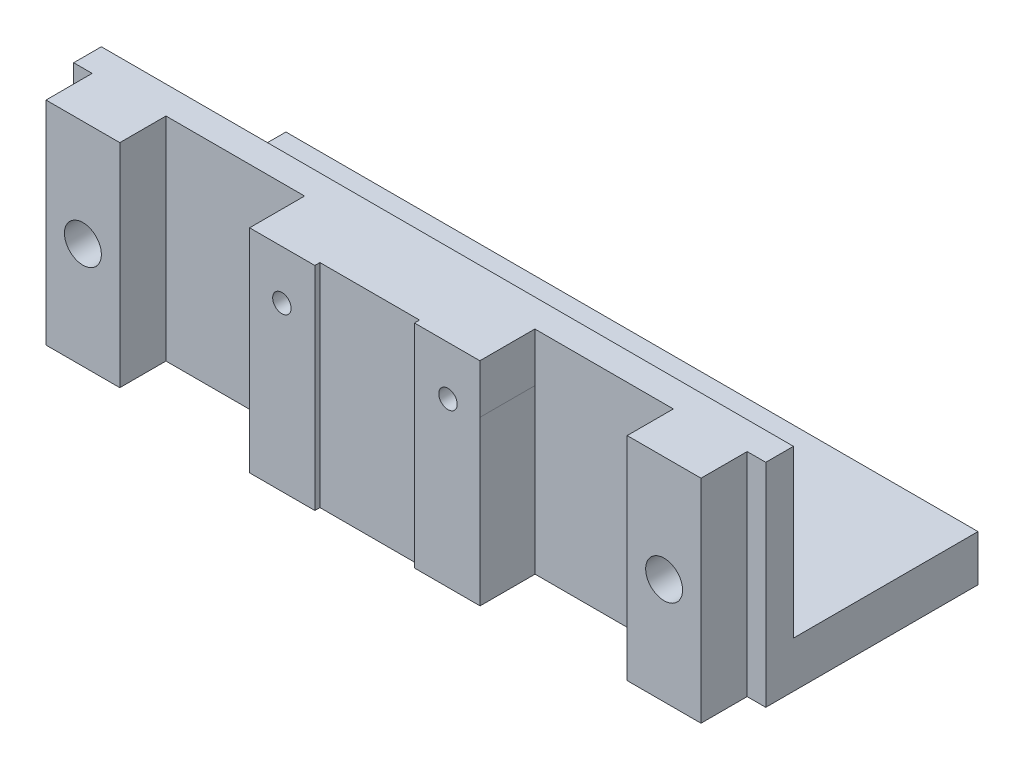
from build123d import *

# Parameters (mm, degrees)
SKETCH1_W            = 50
SKETCH1_H            = 23
BOSS_EXTRUDE12_DEPTH = 3
SKETCH17_W           = 50
SKETCH17_H           = 3
BOSS_EXTRUDE13_DEPTH = 20
BOSS_EXTRUDE15_DEPTH = 25
SKETCH19_R           = 3
CUT_EXTRUDE1_DEPTH   = 10
BOSS_EXTRUDE17_DEPTH = 5.96
CUT_EXTRUDE2_DEPTH   = 58.739515066
SKETCH23_R           = 1
CUT_EXTRUDE3_DEPTH   = 63.190687406
SKETCH24_W           = 8
SKETCH24_H           = 23
BOSS_EXTRUDE20_DEPTH = 5
BOSS_EXTRUDE22_START = 3
SKETCH20_R           = 4
SKETCH20_R_2         = 3
BOSS_EXTRUDE22_DEPTH = 3
SKETCH25_R           = 2
CUT_EXTRUDE4_DEPTH   = 62.749493925
SKETCH26_W           = 75
SKETCH26_H           = 20
BOSS_EXTRUDE23_DEPTH = 2
SKETCH27_R           = 3
CUT_EXTRUDE5_DEPTH   = 57.611408744


with BuildPart() as part:
    # Sketch1 → Boss-Extrude12 (new body)
    with BuildSketch(Plane(origin=(0, 0, 0), x_dir=(1, 0, 0), z_dir=(0, 1, 0))):
        Rectangle(SKETCH1_W, SKETCH1_H)
    extrude(amount=BOSS_EXTRUDE12_DEPTH)

    # Sketch17 → Boss-Extrude13 (add)
    with BuildSketch(Plane(origin=(0, 3, 0), x_dir=(1, 0, 0), z_dir=(0, 1, 0))):
        with Locations((0, -10)):
            Rectangle(SKETCH17_W, SKETCH17_H)
    extrude(amount=BOSS_EXTRUDE13_DEPTH)

    # Sketch18 → Boss-Extrude15 (add)
    with BuildSketch(Plane(origin=(25, 0, 0), x_dir=(0, 0, -1), z_dir=(1, 0, 0))):
        Polygon((-11.5, 23), (-8.5, 23), (-8.5, 3), (11.5, 3), (11.5, 0), (-11.5, 0), align=None)
    extrude(amount=BOSS_EXTRUDE15_DEPTH)

    # Sketch19 → Cut-Extrude1 (cut)
    with BuildSketch(Plane.XZ):
        with Locations((-7.5, -1.069311776)):
            Circle(SKETCH19_R)
        with Locations((12.5, -1.069311776)):
            Circle(SKETCH19_R)
        with Locations((32.5, -1.069311776)):
            Circle(SKETCH19_R)
    extrude(amount=-CUT_EXTRUDE1_DEPTH, mode=Mode.SUBTRACT)

    # Sketch21 → Boss-Extrude17 (add)
    with BuildSketch(Plane.XY.offset(11.5)):
        Polygon((0.022791851, 17.683942334), (0, 0), (25, 0), (24.977208149, 17.683942334), (24.977208149, 23), (0.022791851, 23), align=None)
    extrude(amount=BOSS_EXTRUDE17_DEPTH)

    # Sketch22 → Cut-Extrude2 (cut, through all)
    with BuildSketch(Plane(origin=(0, 23, 0), x_dir=(1, 0, 0), z_dir=(0, 1, 0))):
        Polygon((15.892859801, -16.90901318), (17.890847614, -16.90901318), (17.890847614, -17.46), (7.092859801, -17.46), (7.092859801, -16.90901318), (9.092859801, -16.90901318), align=None)
    extrude(amount=-CUT_EXTRUDE2_DEPTH, mode=Mode.SUBTRACT)

    # Sketch23 → Cut-Extrude3 (cut, through all)
    with BuildSketch(Plane.XY.offset(17.46)):
        with Locations((3.522791851, 17.683942334)):
            Circle(SKETCH23_R)
        with Locations((21.522791851, 17.683942334)):
            Circle(SKETCH23_R)
    extrude(amount=-CUT_EXTRUDE3_DEPTH, mode=Mode.SUBTRACT)

    # Sketch24 → Boss-Extrude20 (add)
    with BuildSketch(Plane.XY.offset(11.5)):
        with Locations((-19, 11.5)):
            Rectangle(SKETCH24_W, SKETCH24_H)
        with Locations((43.983707415, 11.5)):
            Rectangle(SKETCH24_W, SKETCH24_H)
    extrude(amount=BOSS_EXTRUDE20_DEPTH)

    # Sketch20 → Boss-Extrude22 (add)
    # profile 1 of 3: a face of its own
    with BuildSketch(Plane.XZ.offset(BOSS_EXTRUDE22_START)):
        with Locations((-7.5, -1.069311776)):
            Circle(SKETCH20_R)
        with Locations((-7.5, -1.069311776)):
            Circle(SKETCH20_R_2, mode=Mode.SUBTRACT)
    # profile 2 of 3: a face of its own
    with BuildSketch(Plane.XZ.offset(BOSS_EXTRUDE22_START)):
        with Locations((12.5, -1.069311776)):
            Circle(SKETCH20_R)
        with Locations((12.5, -1.069311776)):
            Circle(SKETCH20_R_2, mode=Mode.SUBTRACT)
    # profile 3 of 3: a face of its own
    with BuildSketch(Plane.XZ.offset(BOSS_EXTRUDE22_START)):
        with Locations((32.5, -1.069311776)):
            Circle(SKETCH20_R)
        with Locations((32.5, -1.069311776)):
            Circle(SKETCH20_R_2, mode=Mode.SUBTRACT)
    extrude(amount=-BOSS_EXTRUDE22_DEPTH)

    # Sketch25 → Cut-Extrude4 (cut, through all)
    with BuildSketch(Plane.XY.offset(16.5)):
        with Locations((-19, 11.5)):
            Circle(SKETCH25_R)
        with Locations((43.984708093, 11.497259352)):
            Circle(SKETCH25_R)
    extrude(amount=-CUT_EXTRUDE4_DEPTH, mode=Mode.SUBTRACT)

    # Sketch26 → Boss-Extrude23 (add)
    with BuildSketch(Plane(origin=(0, 3, 0), x_dir=(1, 0, 0), z_dir=(0, 1, 0))):
        with Locations((12.5, 1.5)):
            Rectangle(SKETCH26_W, SKETCH26_H)
    extrude(amount=BOSS_EXTRUDE23_DEPTH)

    # Sketch27 → Cut-Extrude5 (cut, through all)
    with BuildSketch(Plane.XZ.offset(-3)):
        with Locations((-7.5, -1.069311776)):
            Circle(SKETCH27_R)
        with Locations((12.5, -1.069311776)):
            Circle(SKETCH27_R)
        with Locations((32.5, -1.069311776)):
            Circle(SKETCH27_R)
    extrude(amount=-CUT_EXTRUDE5_DEPTH, mode=Mode.SUBTRACT)


solid = part.part
